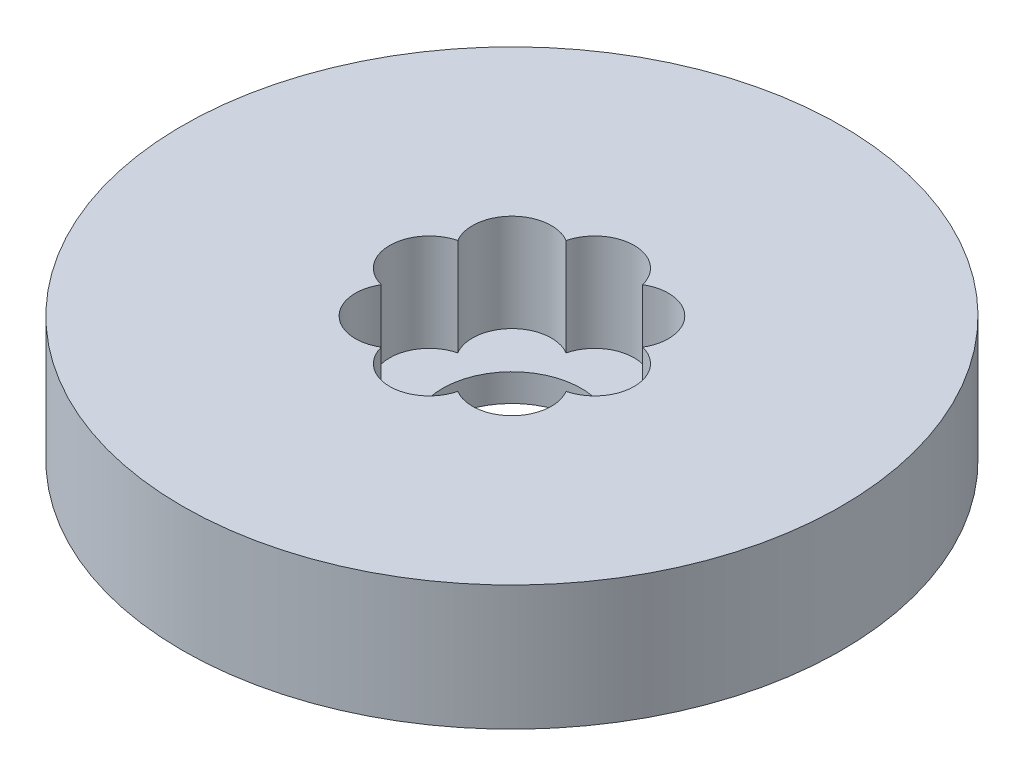
from build123d import *

# Parameters (mm, degrees)
SKETCH1_R           = 47.5
BOSS_EXTRUDE1_DEPTH = 18
SKETCH2_R           = 10
CUT_EXTRUDE1_DEPTH  = 70.544949493
SKETCH3_R           = 5.6939499
CUT_EXTRUDE2_DEPTH  = 14.035391581
CIRPATTERN1_COUNT   = 8


with BuildPart() as part:
    # Sketch1 → Boss-Extrude1 (new body)
    with BuildSketch(Plane(origin=(0, 0, 0), x_dir=(1, 0, 0), z_dir=(0, 1, 0))):
        Circle(SKETCH1_R)
    extrude(amount=BOSS_EXTRUDE1_DEPTH)

    # Sketch2 → Cut-Extrude1 (cut, through all)
    with BuildSketch(Plane(origin=(0, 0, 0), x_dir=(1, 0, 0), z_dir=(0, 1, 0))):
        Circle(SKETCH2_R)
    extrude(amount=CUT_EXTRUDE1_DEPTH, mode=Mode.SUBTRACT)

    # Sketch3 → Cut-Extrude2 (cut)
    with BuildSketch(Plane(origin=(0, 18, 0), x_dir=(1, 0, 0), z_dir=(0, 1, 0))):
        with Locations((-11.92353418, 0)):
            Circle(SKETCH3_R)
    cut_extrude2 = extrude(amount=-CUT_EXTRUDE2_DEPTH, mode=Mode.SUBTRACT)

    # CirPattern1: Cut-Extrude2 ×8 about axis
    cirpattern1_axis = Axis((0, 0, 0), (0, 1, 0))
    for i in range(1, CIRPATTERN1_COUNT):
        add(cut_extrude2.rotate(cirpattern1_axis, i * 360 / CIRPATTERN1_COUNT), mode=Mode.SUBTRACT)


solid = part.part
